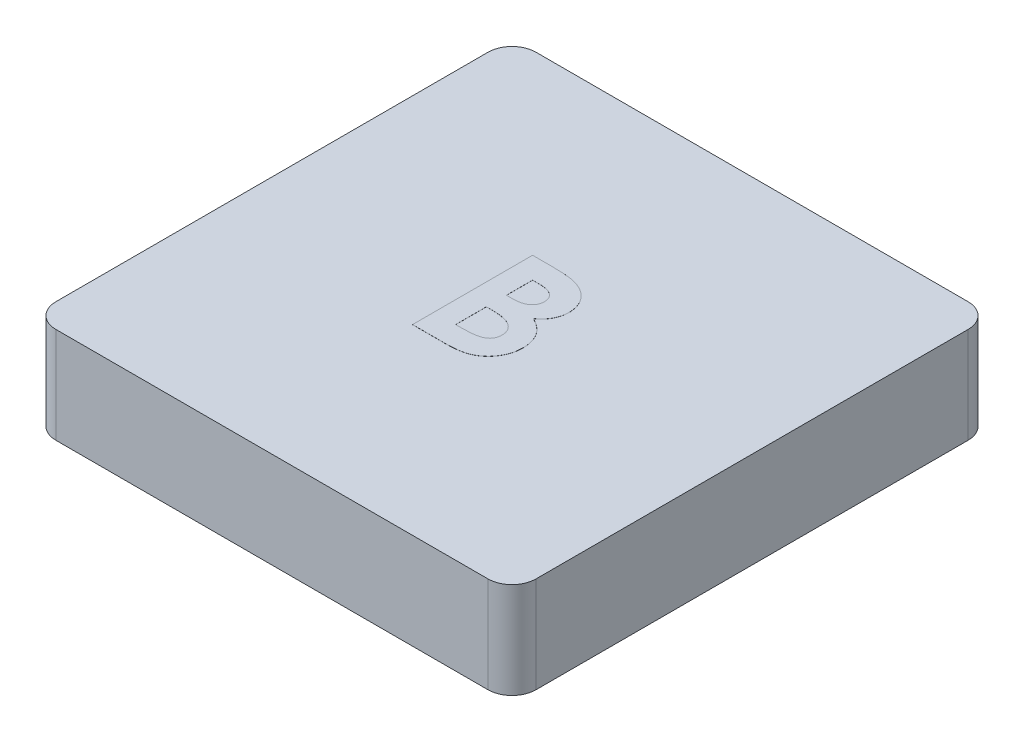
from build123d import *

# Parameters (mm, degrees)
SKETCH1_W           = 12.7
SKETCH1_H           = 12.7
BOSS_EXTRUDE1_DEPTH = 2.54
FILLET1_R           = 0.635
SHELL1_START        = 0.635
SHELL1_OUTLINE_W    = 1.905
SHELL1_OUTLINE_H    = 11.43
SHELL1_DEPTH        = 11.43
SKETCH2_R           = 2.54
BOSS_EXTRUDE2_DEPTH = 1.905
BOSS_EXTRUDE3_DEPTH = 0.00254


# Read off the part's stored shape, not the designer's step: Shell1
with BuildPart() as part:
    # Sketch1 → Boss-Extrude1 (new body)
    with BuildSketch(Plane(origin=(0, 0, 0), x_dir=(1, 0, 0), z_dir=(0, 1, 0))):
        with Locations((6.35, 6.35)):
            Rectangle(SKETCH1_W, SKETCH1_H)
    extrude(amount=BOSS_EXTRUDE1_DEPTH)

    # Fillet1
    fillet1_edges = [part.edges().sort_by_distance(p)[0] for p in [
        (0, 1.27, -12.7),
        (12.7, 1.27, -12.7),
        (12.7, 1.27, 0),
        (0, 1.27, 0),
    ]]
    fillet(fillet1_edges, radius=FILLET1_R)

    # Shell1 outline → Shell1 (cut)
    with BuildSketch(Plane.YZ.offset(SHELL1_START)):
        with Locations((0.9525, -6.35)):
            Rectangle(SHELL1_OUTLINE_W, SHELL1_OUTLINE_H)
    extrude(amount=SHELL1_DEPTH, mode=Mode.SUBTRACT)

    # Sketch2 → Boss-Extrude2 (add)
    with BuildSketch(Plane(origin=(0, 1.905, 0), x_dir=(-1, 0, 0), z_dir=(0, -1, 0))):
        with Locations(Location((-6.35, 6.35, 0), (0, 0, 270))):
            Circle(SKETCH2_R)
    extrude(amount=BOSS_EXTRUDE2_DEPTH)

    # Sketch3 → Boss-Extrude3 (add)
    with BuildSketch(Plane(origin=(0, 2.54, 0), x_dir=(1, 0, 0), z_dir=(0, 1, 0))):
        with BuildLine():
            Line((5.243146154, 4.826), (5.243146154, 8.001))
            Line((5.243146154, 8.001), (5.751960256, 8.001))
            add(Edge.make_bspline(
                [(5.751960256, 8.001), (5.787580425, 8.001004065), (5.856504776, 8.001011931), (5.955944627, 7.99751993), (6.048166691, 7.993002635), (6.132877481, 7.987948833), (6.210221182, 7.979240122), (6.280080178, 7.970062092), (6.34259405, 7.958993954), (6.381242981, 7.94906549), (6.399426202, 7.944394431)],
                knots=[0, 0, 0, 0, 1.311965854, 2.538629056, 3.664479157, 4.713267157, 5.663616078, 6.530575999, 7.308677837, 8, 8, 8, 8], degree=3))
            add(Edge.make_bspline(
                [(6.399426202, 7.944394431), (6.423302618, 7.937805819), (6.470155811, 7.924876846), (6.537264535, 7.898766227), (6.600926521, 7.869742423), (6.661064039, 7.836631691), (6.717307821, 7.799034291), (6.769444122, 7.75665184), (6.818597392, 7.711185567), (6.863022312, 7.66136834), (6.903175119, 7.608727211), (6.93806071, 7.553275975), (6.968371817, 7.495862516), (6.992628642, 7.435764324), (7.010905704, 7.373258168), (7.02427347, 7.308610959), (7.032937594, 7.241618137), (7.03375624, 7.19604073), (7.034171795, 7.172905048)],
                knots=[0, 0, 0, 0, 1.099996261, 2.158545794, 3.195537121, 4.207578794, 5.205712374, 6.197378256, 7.190519799, 8.17788031, 9.159561366, 10.129234751, 11.085776129, 12.040971148, 13.00380137, 13.975669004, 14.972423361, 16, 16, 16, 16], degree=3))
            add(Edge.make_bspline(
                [(7.034171795, 7.172905048), (7.033085241, 7.143181769), (7.030946494, 7.084675147), (7.01728403, 6.998739505), (6.99166478, 6.917517971), (6.958142616, 6.839513663), (6.912562953, 6.765017538), (6.854685596, 6.694065017), (6.785447969, 6.624471365), (6.732338887, 6.582754665), (6.704714663, 6.56105609)],
                knots=[0, 0, 0, 0, 0.986156485, 1.941127874, 2.875419072, 3.804401753, 4.751181392, 5.761612777, 6.835722519, 8, 8, 8, 8], degree=3))
            add(Edge.make_bspline(
                [(6.704714663, 6.56105609), (6.727100009, 6.549628565), (6.770991478, 6.527222351), (6.833304469, 6.490393223), (6.890999497, 6.451220775), (6.944335248, 6.410493172), (6.992192945, 6.366483912), (7.036548712, 6.321728868), (7.075214265, 6.273663764), (7.109790168, 6.22400173), (7.139842981, 6.172023655), (7.166015667, 6.117817318), (7.188122796, 6.061197538), (7.206843685, 6.002452465), (7.220805729, 5.941380042), (7.229909278, 5.877958428), (7.236879525, 5.812403923), (7.237421744, 5.76774983), (7.237697436, 5.745045473)],
                knots=[0, 0, 0, 0, 1.164658916, 2.283573913, 3.35186032, 4.395461096, 5.390182219, 6.362969632, 7.312859996, 8.245001507, 9.165155236, 10.092416118, 11.032087915, 11.979892451, 12.947605196, 13.931445124, 14.948243989, 16, 16, 16, 16], degree=3))
            add(Edge.make_bspline(
                [(7.237697436, 5.745045473), (7.235908383, 5.701681448), (7.232377694, 5.616102718), (7.20656302, 5.490453489), (7.161808578, 5.371326623), (7.101712592, 5.259195582), (7.027662773, 5.157306375), (6.942526717, 5.068052315), (6.847161548, 4.992500734), (6.759175654, 4.941509278), (6.683074784, 4.907289243), (6.620041855, 4.886132259), (6.552345826, 4.866532461), (6.478746667, 4.852769079), (6.400578631, 4.840171317), (6.317079575, 4.832393198), (6.228405558, 4.827122159), (6.167500409, 4.826381615), (6.136114904, 4.826)],
                knots=[0, 0, 0, 0, 1.284142165, 2.534249414, 3.780121997, 5.041676246, 6.291546858, 7.49970053, 8.684500223, 9.883330709, 10.50184324, 11.153274765, 11.851151195, 12.587658647, 13.369265475, 14.195992086, 15.070362669, 16, 16, 16, 16], degree=3))
            Line((6.136114904, 4.826), (5.243146154, 4.826))
        make_face()
        with BuildLine():
            Line((5.813017949, 7.431128205), (5.813017949, 6.739141026))
            Line((5.813017949, 6.739141026), (5.964390144, 6.739141026))
            add(Edge.make_bspline(
                [(5.964390144, 6.739141026), (5.984962986, 6.739320429), (6.024677611, 6.739666755), (6.082041174, 6.744127321), (6.135380025, 6.751737323), (6.184491859, 6.762355191), (6.229834171, 6.775838335), (6.271117303, 6.792061461), (6.308159738, 6.811855437), (6.351194481, 6.841339439), (6.396685308, 6.884726468), (6.436730371, 6.94740802), (6.460316645, 7.019491567), (6.46294352, 7.070330466), (6.4643, 7.096582933)],
                knots=[0, 0, 0, 0, 1.065314748, 2.056525647, 2.977365736, 3.853934255, 4.656397591, 5.425096493, 6.14721249, 6.826394842, 8.123232004, 9.372140726, 10.643011755, 12, 12, 12, 12], degree=3))
            add(Edge.make_bspline(
                [(6.4643, 7.096582933), (6.463214568, 7.12117273), (6.461115928, 7.168716114), (6.437367582, 7.235471259), (6.400481706, 7.29462998), (6.356932744, 7.335119286), (6.315922935, 7.362772289), (6.280807819, 7.380980614), (6.242266343, 7.39728052), (6.199552384, 7.409743825), (6.152909864, 7.419095851), (6.10256535, 7.425963794), (6.048431981, 7.430638408), (6.011041948, 7.430961437), (5.991738902, 7.431128205)],
                knots=[0, 0, 0, 0, 1.347982417, 2.606269829, 3.849316587, 5.153353503, 5.842674298, 6.568177932, 7.326619318, 8.142485038, 9.012069166, 9.942760135, 10.937925643, 12, 12, 12, 12], degree=3))
            Line((5.991738902, 7.431128205), (5.813017949, 7.431128205))
        make_face(mode=Mode.SUBTRACT)
        with BuildLine():
            Line((5.813017949, 6.209974359), (5.813017949, 5.395871795))
            Line((5.813017949, 5.395871795), (5.977110497, 5.395871795))
            add(Edge.make_bspline(
                [(5.977110497, 5.395871795), (6.009551802, 5.396057131), (6.071924261, 5.396413462), (6.161272697, 5.400718795), (6.242512762, 5.408478398), (6.315429202, 5.418165637), (6.3801337, 5.431290331), (6.436407542, 5.447976697), (6.485022448, 5.466334606), (6.525686923, 5.489008804), (6.558907469, 5.515395947), (6.588885529, 5.542364242), (6.613327771, 5.573474717), (6.632666929, 5.607391887), (6.649404936, 5.643273225), (6.65950012, 5.682519883), (6.667186238, 5.723968686), (6.667609226, 5.752637926), (6.667825641, 5.76730609)],
                knots=[0, 0, 0, 0, 1.753078804, 3.370512758, 4.83203934, 6.162291463, 7.344201807, 8.395507345, 9.331626367, 10.147333109, 10.898971645, 11.62040215, 12.321813352, 13.025280112, 13.727906689, 14.453419512, 15.208716525, 16, 16, 16, 16], degree=3))
            add(Edge.make_bspline(
                [(6.667825641, 5.76730609), (6.667348384, 5.784079366), (6.666418815, 5.816749196), (6.658827018, 5.864499638), (6.645030243, 5.909077845), (6.627652532, 5.95162374), (6.603470524, 5.990614032), (6.574731033, 6.027398029), (6.540006391, 6.060730109), (6.500956506, 6.092626322), (6.455408681, 6.120553184), (6.403341547, 6.144784684), (6.344472246, 6.165021941), (6.278618424, 6.181134857), (6.206068781, 6.194809667), (6.126293782, 6.202975038), (6.039957822, 6.209047983), (5.980091063, 6.209658551), (5.949125721, 6.209974359)],
                knots=[0, 0, 0, 0, 0.845221588, 1.646264278, 2.427170338, 3.19324141, 3.95557735, 4.731569926, 5.540061037, 6.376114724, 7.268642756, 8.224665384, 9.265483498, 10.400594375, 11.639216012, 12.983232105, 14.439614077, 16, 16, 16, 16], degree=3))
            Line((5.949125721, 6.209974359), (5.813017949, 6.209974359))
        make_face(mode=Mode.SUBTRACT)
    extrude(amount=BOSS_EXTRUDE3_DEPTH)


solid = part.part
